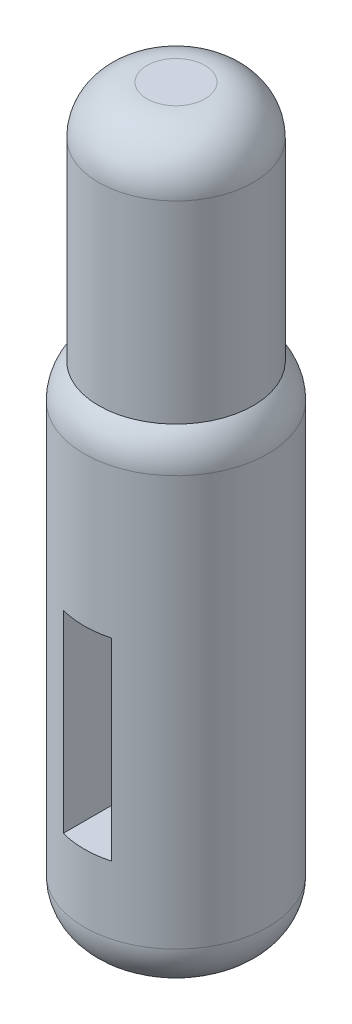
from build123d import *

# Parameters (mm, degrees)
SKETCH1_R               = 19
BOSS_EXTRUDE3_DEPTH     = 102
SKETCH2_R               = 16
BOSS_EXTRUDE4_DEPTH     = 50
FILLET1_R               = 10
FILLET2_R               = 10
FILLET3_R               = 10
CUT_EXTRUDE1_DEPTH      = 155.356729713
CUT_EXTRUDE1_DEPTH_BACK = 155.356729713
SKETCH3_W               = 10
SKETCH3_H               = 40


with BuildPart() as part:
    # Sketch1 → Boss-Extrude3 (new body)
    with BuildSketch(Plane(origin=(0, 0, 0), x_dir=(1, 0, 0), z_dir=(0, 1, 0))):
        with Locations(Location((0, 0, 0), (0, 0, 270))):
            Circle(SKETCH1_R)
    extrude(amount=BOSS_EXTRUDE3_DEPTH)

    # Sketch2 → Boss-Extrude4 (add)
    with BuildSketch(Plane(origin=(0, 102, 0), x_dir=(1, 0, 0), z_dir=(0, 1, 0))):
        with Locations(Location((0, 0, 0), (0, 0, 270))):
            Circle(SKETCH2_R)
    extrude(amount=BOSS_EXTRUDE4_DEPTH)

    # Fillet1
    # the kernel refuses this fillet: 10 mm, written as the material it takes off along each edge
    with BuildSketch(Plane(origin=(0, 102, 0), x_dir=(0, 0, 1), z_dir=(-1, 0, 0))) as fillet1_piece_1:
        with BuildLine():
            CenterArc((9, -7.141428429), FILLET1_R, 0, 45.572995999)
            Line((16, 0), (16.14, 0.142828569))
            ThreePointArc((16.14, 0.142828569), (17.5, 0.2), (19, 0.2))
            Line((19, 0.2), (19.2, 0))
            Line((19.2, 0), (19.2, -7.141428429))
            Line((19.2, -7.141428429), (19, -7.141428429))
        make_face()
    revolve(axis=Axis((0, 102, 0), (0, 1, 0)), mode=Mode.SUBTRACT)

    # Fillet2
    fillet2_edges = [part.edges().sort_by_distance(p)[0] for p in [
        (0, 152, -16),
    ]]
    fillet(fillet2_edges, radius=FILLET2_R)

    # Fillet3
    fillet3_edges = [part.edges().sort_by_distance(p)[0] for p in [
        (0, 0, -19),
    ]]
    fillet(fillet3_edges, radius=FILLET3_R)

    # Sketch3 → Cut-Extrude1 (cut, two sides: drawn at the far end of the back side and taken through both)
    with BuildSketch(Plane.XY.offset(-CUT_EXTRUDE1_DEPTH_BACK)):
        with Locations((0, 44)):
            Rectangle(SKETCH3_W, SKETCH3_H)
    extrude(amount=CUT_EXTRUDE1_DEPTH + CUT_EXTRUDE1_DEPTH_BACK, mode=Mode.SUBTRACT)


solid = part.part
